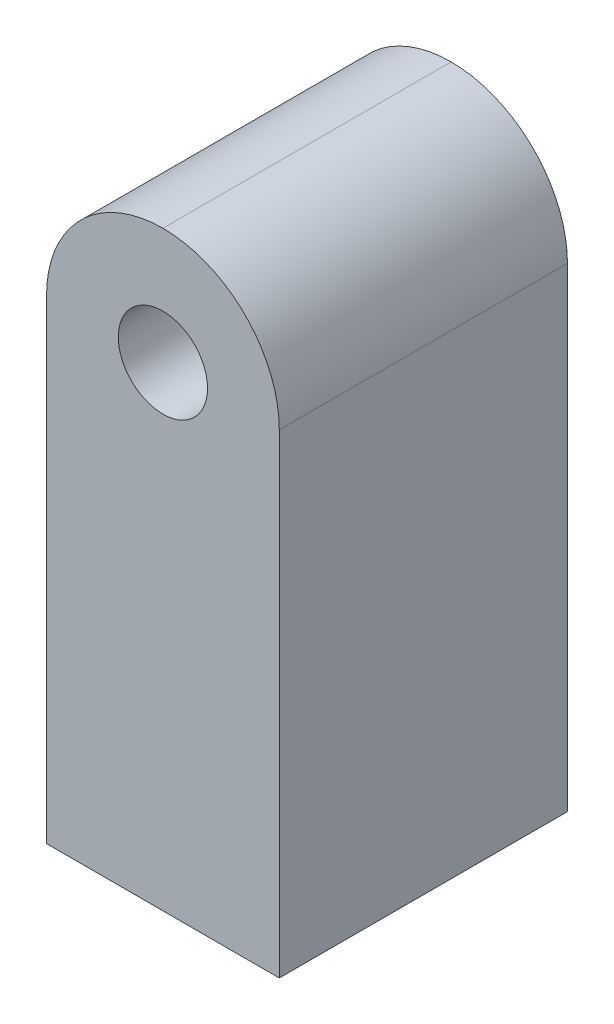
from build123d import *

# Parameters (mm, degrees)
SKETCH1_W               = 40
SKETCH1_H               = 101.6
BOSS_EXTRUDE1_DEPTH     = 49.53
FILLET1_R               = 20
CUT_EXTRUDE2_DEPTH      = 120.899044617
CUT_EXTRUDE2_DEPTH_BACK = 120.899044617
SKETCH2_R               = 7.67


with BuildPart() as part:
    # Sketch1 → Boss-Extrude1 (new body)
    with BuildSketch(Plane.XY):
        with Locations((20, 50.8)):
            Rectangle(SKETCH1_W, SKETCH1_H)
    extrude(amount=BOSS_EXTRUDE1_DEPTH)

    # Fillet1
    fillet1_edges = [part.edges().sort_by_distance(p)[0] for p in [
        (40, 101.6, 24.765),
        (0, 101.6, 24.765),
    ]]
    fillet(fillet1_edges, radius=FILLET1_R - 0.0001)  # a hair under: the kernel refuses the full size

    # Sketch2 → Cut-Extrude2 (cut, two sides: drawn at the far end of the back side and taken through both)
    with BuildSketch(Plane.XY.offset(-CUT_EXTRUDE2_DEPTH_BACK)):
        with Locations((20, 81.6)):
            Circle(SKETCH2_R)
    extrude(amount=CUT_EXTRUDE2_DEPTH + CUT_EXTRUDE2_DEPTH_BACK, mode=Mode.SUBTRACT)


solid = part.part
